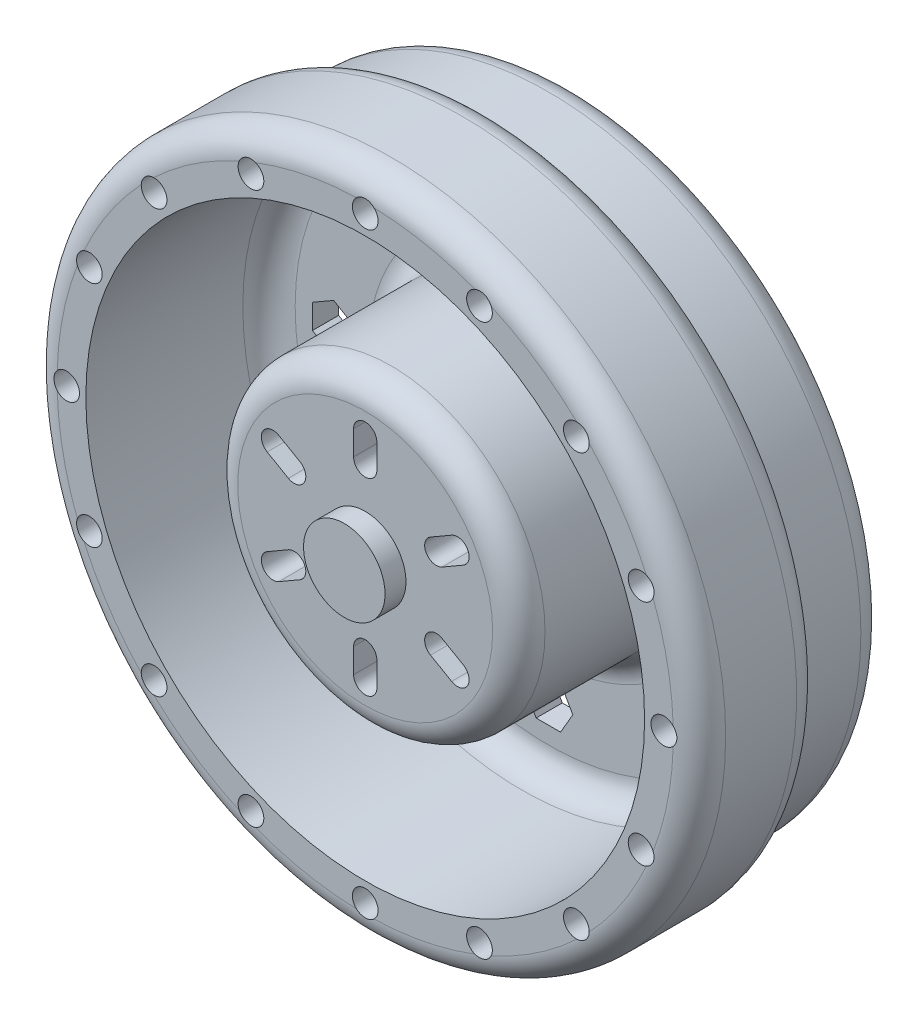
from build123d import *

# Parameters (mm, degrees)
SKETCH1_R           = 64.898622647
BOSS_EXTRUDE1_DEPTH = 40.64
SKETCH2_R           = 54.243220099
CUT_EXTRUDE1_DEPTH  = 35.56
SKETCH4_R           = 2.496399786
CUT_EXTRUDE3_DEPTH  = 17.78
SKETCH5_R           = 29.833771054
BOSS_EXTRUDE2_DEPTH = 35.56
CUT_EXTRUDE4_DEPTH  = 35.56
SKETCH7_R           = 19.437153869
CUT_EXTRUDE5_DEPTH  = 16.764
SKETCH8_R           = 64.898622647
SKETCH8_R_2         = 60.672816656
CUT_EXTRUDE8_DEPTH  = 16.764
CUT_EXTRUDE9_DEPTH  = 16.764
FILLET1_R           = 5.08
FILLET2_R           = 5.08
SKETCH11_R          = 7.910469598
BOSS_EXTRUDE3_DEPTH = 4.064


with BuildPart() as part:
    # Sketch1 → Boss-Extrude1 (new body)
    with BuildSketch(Plane.XY):
        Circle(SKETCH1_R)
    extrude(amount=BOSS_EXTRUDE1_DEPTH)

    # Sketch2 → Cut-Extrude1 (cut)
    with BuildSketch(Plane.XY.offset(40.64)):
        Circle(SKETCH2_R)
    extrude(amount=-CUT_EXTRUDE1_DEPTH, mode=Mode.SUBTRACT)

    # Sketch4 → Cut-Extrude3 (cut)
    with BuildSketch(Plane.XY.offset(40.64)):
        with Locations((0, 57.972441481)):
            Circle(SKETCH4_R)
        with Locations((22.185092888, 53.559552134)):
            Circle(SKETCH4_R)
        with Locations((40.992706493, 40.992706493)):
            Circle(SKETCH4_R)
        with Locations((53.559552134, 22.185092888)):
            Circle(SKETCH4_R)
        with Locations((57.972441481, 0)):
            Circle(SKETCH4_R)
        with Locations((53.559552134, -22.185092888)):
            Circle(SKETCH4_R)
        with Locations((40.992706493, -40.992706493)):
            Circle(SKETCH4_R)
        with Locations((22.185092888, -53.559552134)):
            Circle(SKETCH4_R)
        with Locations((0, -57.972441481)):
            Circle(SKETCH4_R)
        with Locations((-22.185092888, -53.559552134)):
            Circle(SKETCH4_R)
        with Locations((-40.992706493, -40.992706493)):
            Circle(SKETCH4_R)
        with Locations((-53.559552134, -22.185092888)):
            Circle(SKETCH4_R)
        with Locations((-57.972441481, 0)):
            Circle(SKETCH4_R)
        with Locations((-53.559552134, 22.185092888)):
            Circle(SKETCH4_R)
        with Locations((-40.992706493, 40.992706493)):
            Circle(SKETCH4_R)
        with Locations((-22.185092888, 53.559552134)):
            Circle(SKETCH4_R)
    extrude(amount=-CUT_EXTRUDE3_DEPTH, mode=Mode.SUBTRACT)

    # Sketch5 → Boss-Extrude2 (add)
    with BuildSketch(Plane.XY.offset(5.08)):
        Circle(SKETCH5_R)
    extrude(amount=BOSS_EXTRUDE2_DEPTH)

    # Sketch6 → Cut-Extrude4 (cut)
    with BuildSketch(Plane.XY.offset(5.08)):
        Polygon((26.129853846, 32.84210988), (24.901425734, 28.257553751), (28.257553751, 24.901425734), (32.84210988, 26.129853846), (34.070537993, 30.714409976), (30.714409976, 34.070537993), align=None)
        Polygon((-4.746281759, 41.699475451), (-2.373140879, 37.589074875), (2.373140879, 37.589074875), (4.746281759, 41.699475451), (2.373140879, 45.809876028), (-2.373140879, 45.809876028), align=None)
        Polygon((41.699475451, 4.746281759), (37.589074875, 2.373140879), (37.589074875, -2.373140879), (41.699475451, -4.746281759), (45.809876028, -2.373140879), (45.809876028, 2.373140879), align=None)
        Polygon((32.84210988, -26.129853846), (28.257553751, -24.901425734), (24.901425734, -28.257553751), (26.129853846, -32.84210988), (30.714409976, -34.070537993), (34.070537993, -30.714409976), align=None)
        Polygon((4.746281759, -41.699475451), (2.373140879, -37.589074875), (-2.373140879, -37.589074875), (-4.746281759, -41.699475451), (-2.373140879, -45.809876028), (2.373140879, -45.809876028), align=None)
        Polygon((-26.129853846, -32.84210988), (-24.901425734, -28.257553751), (-28.257553751, -24.901425734), (-32.84210988, -26.129853846), (-34.070537993, -30.714409976), (-30.714409976, -34.070537993), align=None)
        Polygon((-41.699475451, -4.746281759), (-37.589074875, -2.373140879), (-37.589074875, 2.373140879), (-41.699475451, 4.746281759), (-45.809876028, 2.373140879), (-45.809876028, -2.373140879), align=None)
        Polygon((-32.84210988, 26.129853846), (-28.257553751, 24.901425734), (-24.901425734, 28.257553751), (-26.129853846, 32.84210988), (-30.714409976, 34.070537993), (-34.070537993, 30.714409976), align=None)
    extrude(amount=-CUT_EXTRUDE4_DEPTH, mode=Mode.SUBTRACT)

    # Sketch7 → Cut-Extrude5 (cut)
    with BuildSketch(Plane(origin=(0, 0, 0), x_dir=(-1, 0, 0), z_dir=(0, 0, -1))):
        Circle(SKETCH7_R)
    extrude(amount=-CUT_EXTRUDE5_DEPTH, mode=Mode.SUBTRACT)

    # Sketch8 → Cut-Extrude8 (cut)
    with BuildSketch(Plane(origin=(0, 0, 0), x_dir=(-1, 0, 0), z_dir=(0, 0, -1))):
        Circle(SKETCH8_R)
        Circle(SKETCH8_R_2, mode=Mode.SUBTRACT)
    extrude(amount=-CUT_EXTRUDE8_DEPTH, mode=Mode.SUBTRACT)

    # Sketch10 → Cut-Extrude9 (cut)
    with BuildSketch(Plane.XY.offset(40.64)):
        with BuildLine():
            Line((2.260134171, 20.680227663), (2.260134171, 15.933945904))
            ThreePointArc((2.260134171, 15.933945904), (0, 13.673811733), (-2.260134171, 15.933945904))
            Line((-2.260134171, 15.933945904), (-2.260134171, 20.680227663))
            ThreePointArc((-2.260134171, 20.680227663), (0, 22.940361834), (2.260134171, 20.680227663))
        make_face()
        with BuildLine():
            Line((19.039669597, 8.382780223), (14.929269021, 6.009639344))
            ThreePointArc((14.929269021, 6.009639344), (11.841868328, 6.836905867), (12.66913485, 9.92430656))
            Line((12.66913485, 9.92430656), (16.779535427, 12.297447439))
            ThreePointArc((16.779535427, 12.297447439), (19.86693612, 11.470180917), (19.039669597, 8.382780223))
        make_face()
        with BuildLine():
            Line((16.779535427, -12.297447439), (12.66913485, -9.92430656))
            ThreePointArc((12.66913485, -9.92430656), (11.841868328, -6.836905867), (14.929269021, -6.009639344))
            Line((14.929269021, -6.009639344), (19.039669597, -8.382780223))
            ThreePointArc((19.039669597, -8.382780223), (19.86693612, -11.470180917), (16.779535427, -12.297447439))
        make_face()
        with BuildLine():
            Line((-2.260134171, -20.680227663), (-2.260134171, -15.933945904))
            ThreePointArc((-2.260134171, -15.933945904), (0, -13.673811733), (2.260134171, -15.933945904))
            Line((2.260134171, -15.933945904), (2.260134171, -20.680227663))
            ThreePointArc((2.260134171, -20.680227663), (0, -22.940361834), (-2.260134171, -20.680227663))
        make_face()
        with BuildLine():
            Line((-19.039669597, -8.382780223), (-14.929269021, -6.009639344))
            ThreePointArc((-14.929269021, -6.009639344), (-11.841868328, -6.836905867), (-12.66913485, -9.92430656))
            Line((-12.66913485, -9.92430656), (-16.779535427, -12.297447439))
            ThreePointArc((-16.779535427, -12.297447439), (-19.86693612, -11.470180917), (-19.039669597, -8.382780223))
        make_face()
        with BuildLine():
            Line((-16.779535427, 12.297447439), (-12.66913485, 9.92430656))
            ThreePointArc((-12.66913485, 9.92430656), (-11.841868328, 6.836905867), (-14.929269021, 6.009639344))
            Line((-14.929269021, 6.009639344), (-19.039669597, 8.382780223))
            ThreePointArc((-19.039669597, 8.382780223), (-19.86693612, 11.470180917), (-16.779535427, 12.297447439))
        make_face()
    extrude(amount=-CUT_EXTRUDE9_DEPTH, mode=Mode.SUBTRACT)

    # Fillet1
    # the kernel refuses this fillet: 5.08 mm, written as the material it takes off along each edge
    with BuildSketch(Plane(origin=(0, 0, 16.764), x_dir=(1, 0, 0), z_dir=(0, -1, 0))) as fillet1_piece_1:
        with BuildLine():
            CenterArc((59.818622647, 5.007669377), FILLET1_R, 279.68018211, 80.31981789)
            Line((60.672816656, 0), (64.898622647, 0))
            Line((64.898622647, 0), (64.898622647, 5.007669377))
        make_face()
    revolve(axis=Axis((0, 0, 16.764), (0, 0, 1)), mode=Mode.SUBTRACT)
    with BuildSketch(Plane(origin=(0, 0, 40.64), x_dir=(1, 0, 0), z_dir=(0, -1, 0))) as fillet1_piece_2:
        with BuildLine():
            CenterArc((64.898622647 - FILLET1_R, -FILLET1_R), FILLET1_R, 0, 90)
            Line((64.898622647 - FILLET1_R, 0), (64.898622647, 0))
            Line((64.898622647, 0), (64.898622647, -FILLET1_R))
        make_face()
    revolve(axis=Axis((0, 0, 40.64), (0, 0, 1)), mode=Mode.SUBTRACT)
    with BuildSketch(Plane(origin=(0, 0, 40.64), x_dir=(1, 0, 0), z_dir=(0, -1, 0))) as fillet1_piece_3:
        with BuildLine():
            CenterArc((29.833771054 - FILLET1_R, -FILLET1_R), FILLET1_R, 0, 90)
            Line((29.833771054 - FILLET1_R, 0), (29.833771054, 0))
            Line((29.833771054, 0), (29.833771054, -FILLET1_R))
        make_face()
    revolve(axis=Axis((0, 0, 40.64), (0, 0, 1)), mode=Mode.SUBTRACT)

    # Fillet2
    fillet2_edges = [part.edges().sort_by_distance(p)[0] for p in [
        (19.437153869, 0, 16.764),
        (19.437153869, 0, 0),
        (60.672816656, 0, 0),
        (-54.243220099, 0, 5.08),
        (-29.833771054, 0, 5.08),
    ]]
    fillet(fillet2_edges, radius=FILLET2_R)

    # Sketch11 → Boss-Extrude3 (add)
    with BuildSketch(Plane.XY.offset(40.64)):
        Circle(SKETCH11_R)
    extrude(amount=BOSS_EXTRUDE3_DEPTH)


solid = part.part
